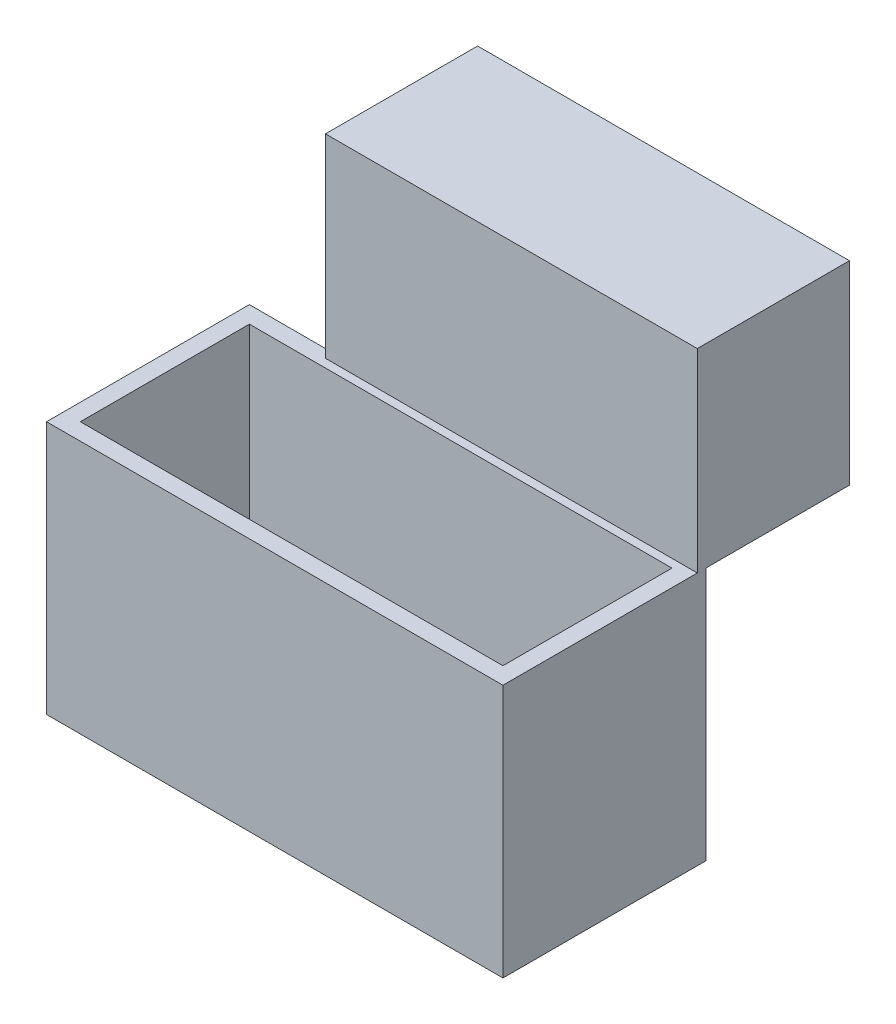
from build123d import *

# Parameters (mm, degrees)
SURFACE_EXTRUSION1_1_DEPTH = 30
EPAISSIR1_T1               = 2
EPAISSIR2_OUTLINE_W        = 50
EPAISSIR2_OUTLINE_H        = 20
EPAISSIR2_DEPTH            = 2
BOSS_EXTRU_1_DEPTH         = 17
BOSS_EXTRU_1_DEPTH_BACK    = 1
ESQUISSE2_W                = 44
ESQUISSE2_H                = 23
ESQUISSE3_W                = 11.316968607
ESQUISSE3_H                = 6
ENL_V_MAT_EXTRU_1_DEPTH    = 47


# Read off the part's stored shape, not the designer's step: Epaissir2
with BuildPart() as body_1:
    # Surface-Extrusion1: a surface, the sketch's curves swept straight by 30 mm
    with BuildLine(Plane(origin=(0, 0, 0), x_dir=(1, 0, 0), z_dir=(0, 1, 0)), mode=Mode.PRIVATE) as surface_extrusion1_1_path:
        Line((0, 0), (-50, 0))
        Line((-50, 0), (-50, 20))
        Line((-50, 20), (0, 20))
        Line((0, 20), (0, 0))
    surface_extrusion1_1 = Shell.extrude(surface_extrusion1_1_path.wire(), (0 * SURFACE_EXTRUSION1_1_DEPTH, 1 * SURFACE_EXTRUSION1_1_DEPTH, 0 * SURFACE_EXTRUSION1_1_DEPTH))
    add(Solid.thicken(surface_extrusion1_1, EPAISSIR1_T1))

    # Epaissir2 outline → Epaissir2 (add)
    with BuildSketch(Plane(origin=(0, 0, 0), x_dir=(1, 0, 0), z_dir=(0, 1, 0))):
        with Locations((-25, 10)):
            Rectangle(EPAISSIR2_OUTLINE_W, EPAISSIR2_OUTLINE_H)
    extrude(amount=EPAISSIR2_DEPTH)

    # Esquisse2 → Boss.-Extru.1 (add, two sides: drawn at the far end of the back side and taken through both)
    with BuildSketch(Plane(origin=(0, 0, -22), x_dir=(-1, 0, 0), z_dir=(0, 0, -1)).offset(-BOSS_EXTRU_1_DEPTH_BACK)):
        with Locations((20, 41.5)):
            Rectangle(ESQUISSE2_W, ESQUISSE2_H)
    extrude(amount=BOSS_EXTRU_1_DEPTH + BOSS_EXTRU_1_DEPTH_BACK)

    # Esquisse3 → Enlèv. mat.-Extru.1 (cut)
    with BuildSketch(Plane.ZY.offset(52)):
        with Locations((-33.341515696, 48)):
            Rectangle(ESQUISSE3_W, ESQUISSE3_H)
    extrude(amount=-ENL_V_MAT_EXTRU_1_DEPTH, mode=Mode.SUBTRACT)


solid = body_1.part
